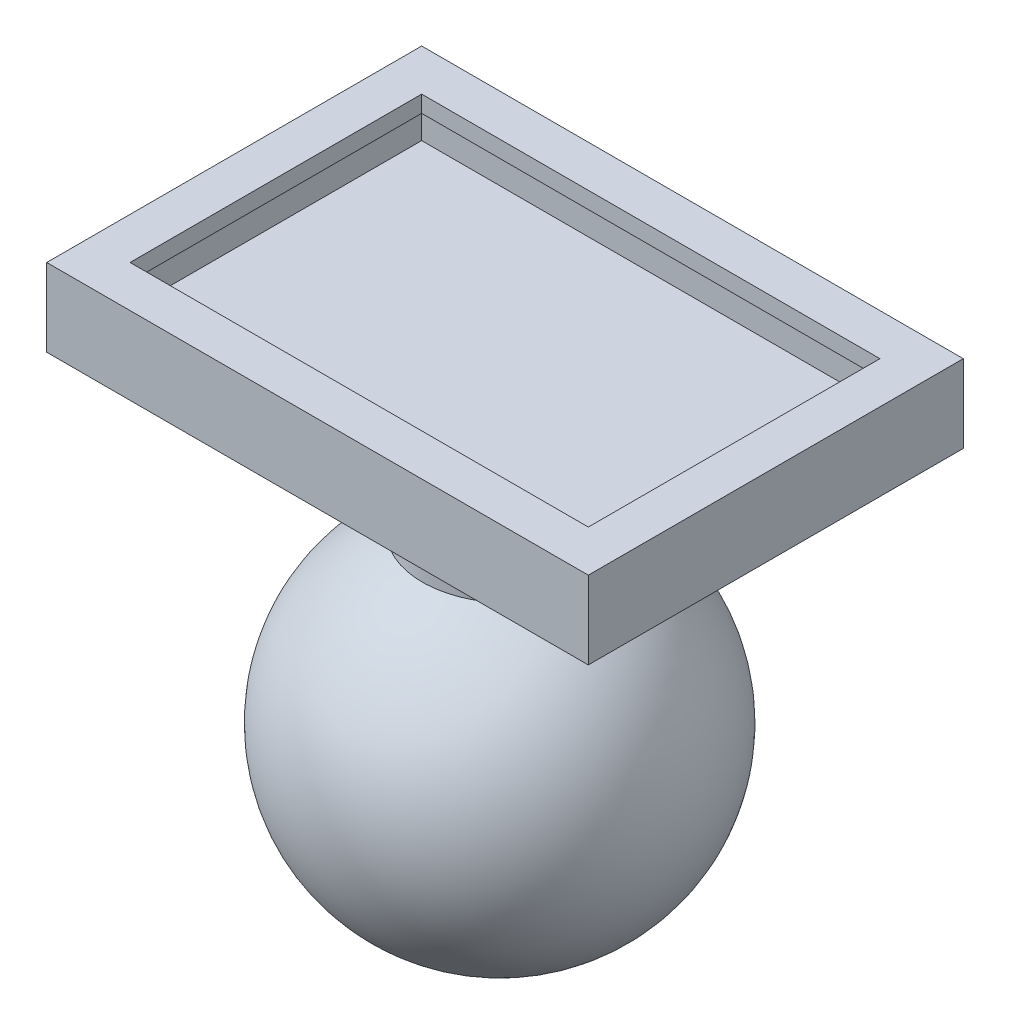
from build123d import *

# Parameters (mm, degrees)
ESQUISSE1_W        = 39
ESQUISSE1_H        = 27
ESQUISSE1_W_2      = 33
ESQUISSE1_H_2      = 21
BOSS_EXTRU_1_DEPTH = 1.2
ESQUISSE2_W        = 39
ESQUISSE2_H        = 27
ESQUISSE2_W_2      = 36
ESQUISSE2_H_2      = 24
BOSS_EXTRU_3_DEPTH = 3.2
ESQUISSE3_W        = 39
ESQUISSE3_H        = 27
BOSS_EXTRU_4_DEPTH = 1.2
ESQUISSE5_R        = 6
BOSS_EXTRU_6_DEPTH = 20
ESQUISSE6_R        = 7.123023745
BOSS_EXTRU_7_DEPTH = 1.5
CONG_1_R           = 1.2


with BuildPart() as part:
    # Esquisse1 → Boss.-Extru.1 (new body)
    with BuildSketch(Plane(origin=(0, 0, 0), x_dir=(1, 0, 0), z_dir=(0, 1, 0))):
        with Locations((16.5, 10.5)):
            Rectangle(ESQUISSE1_W, ESQUISSE1_H)
        with Locations((16.5, 10.5)):
            Rectangle(ESQUISSE1_W_2, ESQUISSE1_H_2, mode=Mode.SUBTRACT)
    extrude(amount=BOSS_EXTRU_1_DEPTH)

    # Esquisse2 → Boss.-Extru.3 (add)
    with BuildSketch(Plane(origin=(0, 0, 0), x_dir=(-1, 0, 0), z_dir=(0, -1, 0))):
        with Locations((-16.5, 10.5)):
            Rectangle(ESQUISSE2_W, ESQUISSE2_H)
        with Locations((-16.5, 10.5)):
            Rectangle(ESQUISSE2_W_2, ESQUISSE2_H_2, mode=Mode.SUBTRACT)
    extrude(amount=BOSS_EXTRU_3_DEPTH)

    # Esquisse3 → Boss.-Extru.4 (add)
    with BuildSketch(Plane(origin=(0, -3.2, 0), x_dir=(-1, 0, 0), z_dir=(0, -1, 0))):
        with Locations((-16.5, 10.5)):
            Rectangle(ESQUISSE3_W, ESQUISSE3_H)
    extrude(amount=BOSS_EXTRU_4_DEPTH)

    # Esquisse5 → Boss.-Extru.6 (add)
    with BuildSketch(Plane(origin=(0, -4.4, 0), x_dir=(-1, 0, 0), z_dir=(0, -1, 0))):
        with Locations(Location((-16.5, 10.5, 0), (0, 0, 90))):
            Circle(ESQUISSE5_R)
    extrude(amount=BOSS_EXTRU_6_DEPTH)

    # Esquisse6 → Boss.-Extru.7 (add)
    with BuildSketch(Plane.XZ.offset(4.4)):
        with Locations(Location((16.5, -10.5, 0), (0, 0, 270))):
            Circle(ESQUISSE6_R)
    extrude(amount=BOSS_EXTRU_7_DEPTH)

    # Congé1
    # the kernel refuses this fillet: 1.2 mm, written as the material it takes off along each edge
    with BuildSketch(Plane(origin=(16.5, -5.9, -10.5), x_dir=(0, 0, -1), z_dir=(-1, 0, 0))) as cong_1_piece_1:
        with BuildLine():
            CenterArc((5.923023745, -1.197528562), CONG_1_R, 0, 86.32212933)
            Line((6, 0), (6.001539525, 0.023950571))
            ThreePointArc((6.001539525, 0.023950571), (6.561511873, 0.024), (7.123023745, 0.024))
            Line((7.123023745, 0.024), (7.147023745, 0))
            Line((7.147023745, 0), (7.147023745, -1.197528562))
            Line((7.147023745, -1.197528562), (7.123023745, -1.197528562))
        make_face()
    revolve(axis=Axis((16.5, -5.9, -10.5), (0, -1, 0)), mode=Mode.SUBTRACT)

    # Esquisse7 → Révolution2 (revolve)
    with BuildSketch(Plane.XZ.offset(24.4)):
        with BuildLine():
            Line((3.633416396, -7.841279791), (29.203795551, -12.548265009))
            ThreePointArc((29.203795551, -12.548265009), (14.065113365, -22.979961978), (3.633416396, -7.841279791))
        make_face()
    revolve(axis=Axis((3.633416396, -24.4, -7.841279791), (0.9834761213686738, 0, -0.181037892988263)))


solid = part.part
